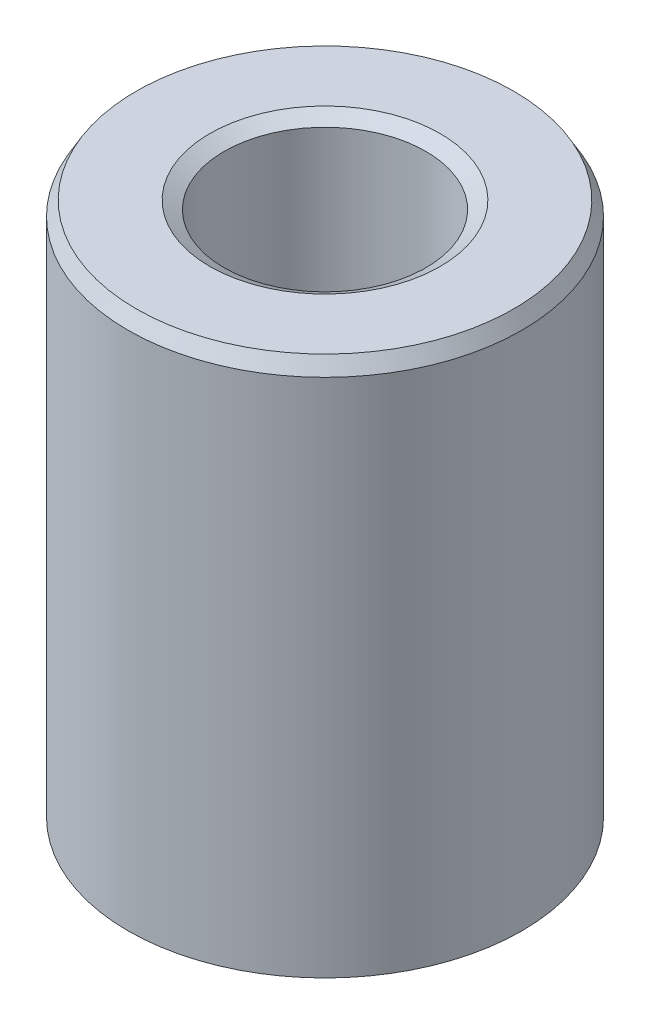
from build123d import *
from OCP.BRepFilletAPI import BRepFilletAPI_MakeChamfer

# Parameters (mm, degrees)
SKETCH1_R           = 40
BOSS_EXTRUDE1_DEPTH = 110.235664165
SKETCH2_R           = 20.486027022
CUT_EXTRUDE1_DEPTH  = 124.902791146
CHAMFER1_SIZE       = 2.908983057
CHAMFER1_SIZE2      = 1.679502151


with BuildPart() as part:
    # Sketch1 → Boss-Extrude1 (new body)
    with BuildSketch(Plane(origin=(0, 0, 0), x_dir=(1, 0, 0), z_dir=(0, 1, 0))):
        Circle(SKETCH1_R)
    extrude(amount=BOSS_EXTRUDE1_DEPTH)

    # Sketch2 → Cut-Extrude1 (cut, through all)
    with BuildSketch(Plane(origin=(0, 0, 0), x_dir=(1, 0, 0), z_dir=(0, 1, 0))):
        Circle(SKETCH2_R)
    extrude(amount=CUT_EXTRUDE1_DEPTH, mode=Mode.SUBTRACT)

    # Chamfer1: one chamfer whose edges measure the first distance from different faces: ONE call of the kernel's chamfer builder (chamfer() names one face for all edges)
    chamfer1_edges_1 = [part.edges().sort_by_distance(p)[0] for p in [
        (-20.486027022, 110.235664165, 0),
    ]]
    chamfer1_side_1 = [part.faces().sort_by_distance(p)[0] for p in [
        (-38.86862915, 110.235664165, 0),
    ]]
    chamfer1_edges_2 = [part.edges().sort_by_distance(p)[0] for p in [
        (-20.486027022, 0, 0),
    ]]
    chamfer1_side_2 = [part.faces().sort_by_distance(p)[0] for p in [
        (-20.486027022, 55.117832082, 0),
    ]]
    chamfer1_edges_3 = [part.edges().sort_by_distance(p)[0] for p in [
        (-40, 0, 0),
    ]]
    chamfer1_side_3 = [part.faces().sort_by_distance(p)[0] for p in [
        (-38.86862915, 0, 0),
    ]]
    chamfer1_edges_4 = [part.edges().sort_by_distance(p)[0] for p in [
        (-40, 110.235664165, 0),
    ]]
    chamfer1_side_4 = [part.faces().sort_by_distance(p)[0] for p in [
        (-40, 55.117832082, 0),
    ]]
    chamfer1 = BRepFilletAPI_MakeChamfer(part.part.solid().wrapped)
    for e in chamfer1_edges_1:
        chamfer1.Add(CHAMFER1_SIZE, CHAMFER1_SIZE2, e.wrapped, chamfer1_side_1[0].wrapped)  # the first distance lies on this face
    for e in chamfer1_edges_2:
        chamfer1.Add(CHAMFER1_SIZE, CHAMFER1_SIZE2, e.wrapped, chamfer1_side_2[0].wrapped)  # the first distance lies on this face
    for e in chamfer1_edges_3:
        chamfer1.Add(CHAMFER1_SIZE, CHAMFER1_SIZE2, e.wrapped, chamfer1_side_3[0].wrapped)  # the first distance lies on this face
    for e in chamfer1_edges_4:
        chamfer1.Add(CHAMFER1_SIZE, CHAMFER1_SIZE2, e.wrapped, chamfer1_side_4[0].wrapped)  # the first distance lies on this face
    add(Compound.cast(chamfer1.Shape()), mode=Mode.REPLACE)


solid = part.part
